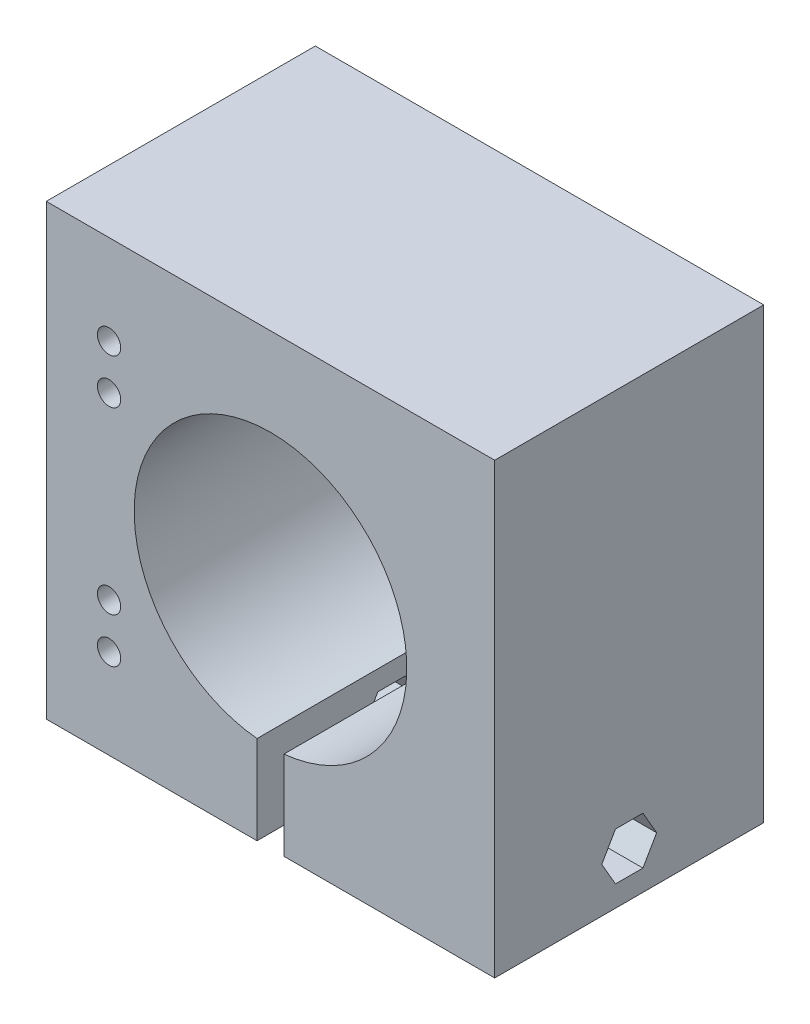
from build123d import *

# Parameters (mm, degrees)
SKETCH1_W           = 50
SKETCH1_H           = 50
SKETCH1_R           = 15.2
SKETCH1_R_2         = 1.3
BOSS_EXTRUDE1_DEPTH = 30
CUT_EXTRUDE1_REACH  = 78.811
SKETCH2_W           = 3
SKETCH2_H           = 11.709133009
CUT_EXTRUDE2_DEPTH  = 54
CUT_EXTRUDE3_DEPTH  = 5


with BuildPart() as part:
    # Sketch1 → Boss-Extrude1 (new body)
    with BuildSketch(Plane.XY):
        with Locations((25, 25)):
            Rectangle(SKETCH1_W, SKETCH1_H)
        with Locations((25, 25)):
            Circle(SKETCH1_R, mode=Mode.SUBTRACT)
        with Locations((7, 15)):
            Circle(SKETCH1_R_2, mode=Mode.SUBTRACT)
        with Locations((7, 40)):
            Circle(SKETCH1_R_2, mode=Mode.SUBTRACT)
        with Locations((7, 10)):
            Circle(SKETCH1_R_2, mode=Mode.SUBTRACT)
        with Locations((7, 35)):
            Circle(SKETCH1_R_2, mode=Mode.SUBTRACT)
    extrude(amount=BOSS_EXTRUDE1_DEPTH)

    # Sketch2 → Cut-Extrude1 (cut, up to next)
    with BuildSketch(Plane.XY.offset(30), mode=Mode.PRIVATE) as cut_extrude1_sk1:
        with Locations((25, 5.854566505)):
            Rectangle(SKETCH2_W, SKETCH2_H)
    cut_extrude1_tool1 = extrude(cut_extrude1_sk1.sketch, amount=-CUT_EXTRUDE1_REACH, mode=Mode.PRIVATE) & part.part
    add(cut_extrude1_tool1.solids().sort_by_distance((25, 5.854567, 30))[0], mode=Mode.SUBTRACT)

    # Sketch3 → Cut-Extrude2 (cut)
    with BuildSketch(Plane(origin=(50, 0, 0), x_dir=(0, 0, -1), z_dir=(1, 0, 0))):
        Polygon((-11.940043573, 5), (-13.470021787, 7.65), (-16.529978213, 7.65), (-18.059956427, 5), (-16.529978213, 2.35), (-13.470021787, 2.35), align=None)
    extrude(amount=-CUT_EXTRUDE2_DEPTH, mode=Mode.SUBTRACT)

    # Sketch4 → Cut-Extrude3 (cut)
    with BuildSketch(Plane.ZY):
        Polygon((19.792007234, 5), (17.396003617, 9.15), (12.603996383, 9.15), (10.207992766, 5), (12.603996383, 0.85), (17.396003617, 0.85), align=None)
    extrude(amount=-CUT_EXTRUDE3_DEPTH, mode=Mode.SUBTRACT)


solid = part.part
